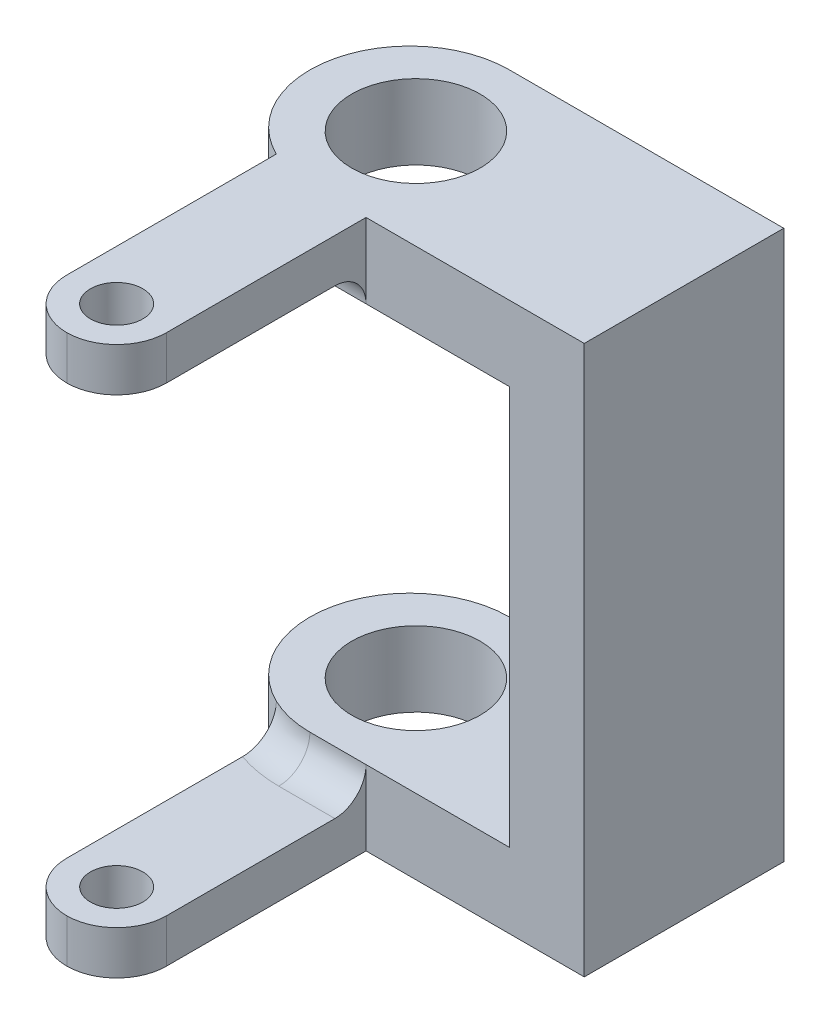
from build123d import *

# Parameters (mm, degrees)
SKETCH1_W                       = 3
SKETCH1_H                       = 8
BOSS_EXTRUDE1_DEPTH             = 8
SKETCH2_W                       = 15
SKETCH2_H                       = 8
BOSS_EXTRUDE2_DEPTH             = 3
SKETCH3_R                       = 2.575
CUT_EXTRUDE1_DEPTH              = 3
FILLET1_R                       = 4
SKETCH4_W                       = 4
SKETCH4_H                       = 1.75
BOSS_EXTRUDE3_DEPTH             = 10
BOSS_EXTRUDE3_DIRECTION_2_REACH = 21.164
SKETCH5_R                       = 1.05
CUT_EXTRUDE2_DEPTH              = 3
FILLET2_R                       = 2
FILLET3_R                       = 1.25
FILLET1_OF_MIRROR1_R            = 4
FILLET2_OF_MIRROR1_R            = 2
FILLET3_OF_MIRROR1_R            = 1.25


with BuildPart() as part:
    # Sketch1 → Boss-Extrude1 (new body)
    with BuildSketch(Plane(origin=(0, 0, 0), x_dir=(1, 0, 0), z_dir=(0, 1, 0))):
        Rectangle(SKETCH1_W, SKETCH1_H)
    boss_extrude1 = extrude(amount=BOSS_EXTRUDE1_DEPTH)

    # Sketch2 → Boss-Extrude2 (add)
    with BuildSketch(Plane(origin=(0, 8, 0), x_dir=(1, 0, 0), z_dir=(0, 1, 0))):
        with Locations((-6, 0)):
            Rectangle(SKETCH2_W, SKETCH2_H)
    boss_extrude2 = extrude(amount=BOSS_EXTRUDE2_DEPTH)

    # Sketch3 → Cut-Extrude1 (cut)
    with BuildSketch(Plane(origin=(0, 11, 0), x_dir=(1, 0, 0), z_dir=(0, 1, 0))):
        with Locations(Location((-9.25, 0, 0), (0, 0, 270))):
            Circle(SKETCH3_R)
    cut_extrude1 = extrude(amount=-CUT_EXTRUDE1_DEPTH, mode=Mode.SUBTRACT)

    # Fillet1
    fillet1_edges = [part.edges().sort_by_distance(p)[0] for p in [
        (-13.5, 9.5, 4),
        (-13.5, 9.5, -4),
    ]]
    fillet(fillet1_edges, radius=FILLET1_R - 0.0001)  # a hair under: the kernel refuses the full size

    # Sketch4 → Boss-Extrude3 (add)
    with BuildSketch(Plane.XY.offset(4)):
        with Locations((-9.25, 10.125)):
            Rectangle(SKETCH4_W, SKETCH4_H)
    boss_extrude3 = extrude(amount=BOSS_EXTRUDE3_DEPTH)

    # Sketch4 → Boss-Extrude3 direction 2 (add, up to next)
    with BuildSketch(Plane.XY.offset(4), mode=Mode.PRIVATE) as boss_extrude3_direction_2_sk1:
        with Locations((-9.25, 10.125)):
            Rectangle(SKETCH4_W, SKETCH4_H)
    boss_extrude3_direction_2_tool1 = extrude(boss_extrude3_direction_2_sk1.sketch, amount=-BOSS_EXTRUDE3_DIRECTION_2_REACH, mode=Mode.PRIVATE) - part.part
    boss_extrude3_direction_2 = boss_extrude3_direction_2_tool1.solids().sort_by_distance((-9.25, 10.125, 4))[0]
    add(boss_extrude3_direction_2)

    # Sketch5 → Cut-Extrude2 (cut)
    with BuildSketch(Plane(origin=(0, 11, 0), x_dir=(1, 0, 0), z_dir=(0, 1, 0))):
        with Locations(Location((-9.25, -12, 0), (0, 0, 270))):
            Circle(SKETCH5_R)
    cut_extrude2 = extrude(amount=-CUT_EXTRUDE2_DEPTH, mode=Mode.SUBTRACT)

    # Fillet2
    fillet2_edges = [part.edges().sort_by_distance(p)[0] for p in [
        (-11.25, 10.125, 14),
        (-7.25, 10.125, 14),
    ]]
    fillet(fillet2_edges, radius=FILLET2_R - 0.0001)  # a hair under: the kernel refuses the full size

    # Fillet3
    fillet3_edges = [part.edges().sort_by_distance(p)[0] for p in [
        (-8.37505, 9.25, 4),
        (-10.397962835, 9.25, 3.897925335),
    ]]
    fillet(fillet3_edges, radius=FILLET3_R - 0.0001)  # a hair under: the kernel refuses the full size

    # Mirror1: Boss-Extrude1, Boss-Extrude2, Cut-Extrude1, Boss-Extrude3, Boss-Extrude3 direction 2, Cut-Extrude2 across plane
    add(boss_extrude1.mirror(Plane.ZX))
    add(boss_extrude2.mirror(Plane.ZX))
    add(cut_extrude1.mirror(Plane.ZX), mode=Mode.SUBTRACT)
    add(boss_extrude3.mirror(Plane.ZX))
    add(boss_extrude3_direction_2.mirror(Plane.ZX))
    add(cut_extrude2.mirror(Plane.ZX), mode=Mode.SUBTRACT)

    # Fillet1 of Mirror1
    fillet1_of_mirror1_edges = [part.edges().sort_by_distance(p)[0] for p in [
        (-13.5, -9.5, 4),
        (-13.5, -9.5, -4),
    ]]
    fillet(fillet1_of_mirror1_edges, radius=FILLET1_OF_MIRROR1_R - 0.0001)  # a hair under: the kernel refuses the full size

    # Fillet2 of Mirror1
    fillet2_of_mirror1_edges = [part.edges().sort_by_distance(p)[0] for p in [
        (-11.25, -10.125, 14),
        (-7.25, -10.125, 14),
    ]]
    fillet(fillet2_of_mirror1_edges, radius=FILLET2_OF_MIRROR1_R - 0.0001)  # a hair under: the kernel refuses the full size

    # Fillet3 of Mirror1
    fillet3_of_mirror1_edges = [part.edges().sort_by_distance(p)[0] for p in [
        (-8.37505, -9.25, 4),
        (-10.397962835, -9.25, 3.897925335),
    ]]
    fillet(fillet3_of_mirror1_edges, radius=FILLET3_OF_MIRROR1_R - 0.0001)  # a hair under: the kernel refuses the full size


solid = part.part
